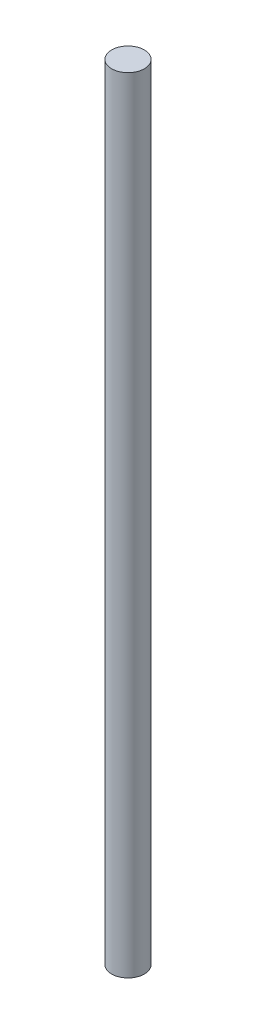
from build123d import *

# Parameters (mm, degrees)
SKETCH1_R           = 3.175
BOSS_EXTRUDE1_DEPTH = 152.4


with BuildPart() as part:
    # Sketch1 → Boss-Extrude1 (new body)
    with BuildSketch(Plane(origin=(0, 0, 0), x_dir=(1, 0, 0), z_dir=(0, 1, 0))):
        Circle(SKETCH1_R)
    extrude(amount=BOSS_EXTRUDE1_DEPTH)


solid = part.part
